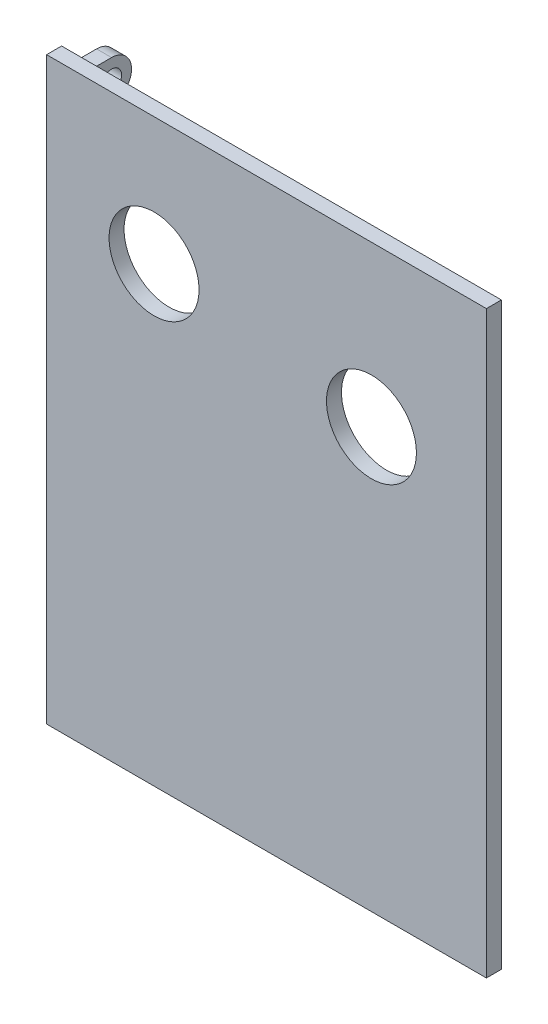
from build123d import *

# Parameters (mm, degrees)
SKETCH1_W           = 88
SKETCH1_H           = 116
BOSS_EXTRUDE1_DEPTH = 3
SKETCH2_R           = 9
CUT_EXTRUDE1_DEPTH  = 73.862884928
SKETCH4_R           = 2
BOSS_EXTRUDE3_DEPTH = 3


with BuildPart() as part:
    # Sketch1 → Boss-Extrude1 (new body)
    with BuildSketch(Plane.XY):
        Rectangle(SKETCH1_W, SKETCH1_H)
    extrude(amount=BOSS_EXTRUDE1_DEPTH)

    # Sketch2 → Cut-Extrude1 (cut, through all)
    with BuildSketch(Plane.XY.offset(3)):
        with Locations((-22.5, 32.5)):
            Circle(SKETCH2_R)
        with Locations((21, 26)):
            Circle(SKETCH2_R)
    extrude(amount=-CUT_EXTRUDE1_DEPTH, mode=Mode.SUBTRACT)

    # Sketch4 → Boss-Extrude3 (add)
    # profile 1 of 2: a face of its own
    with BuildSketch(Plane.ZY.offset(44)):
        with BuildLine():
            Line((-7, 54), (0, 54))
            Line((0, 54), (0, 46))
            Line((0, 46), (-7, 46))
            ThreePointArc((-7, 46), (-11, 50), (-7, 54))
        make_face()
        with Locations((-7, 50)):
            Circle(SKETCH4_R, mode=Mode.SUBTRACT)
    # profile 2 of 2: a face of its own
    with BuildSketch(Plane.ZY.offset(44)):
        with BuildLine():
            Line((0, -46), (-7, -46))
            ThreePointArc((-7, -46), (-11, -50), (-7, -54))
            Line((-7, -54), (0, -54))
            Line((0, -54), (0, -46))
        make_face()
        with Locations((-7, -50)):
            Circle(SKETCH4_R, mode=Mode.SUBTRACT)
    extrude(amount=-BOSS_EXTRUDE3_DEPTH)


solid = part.part
